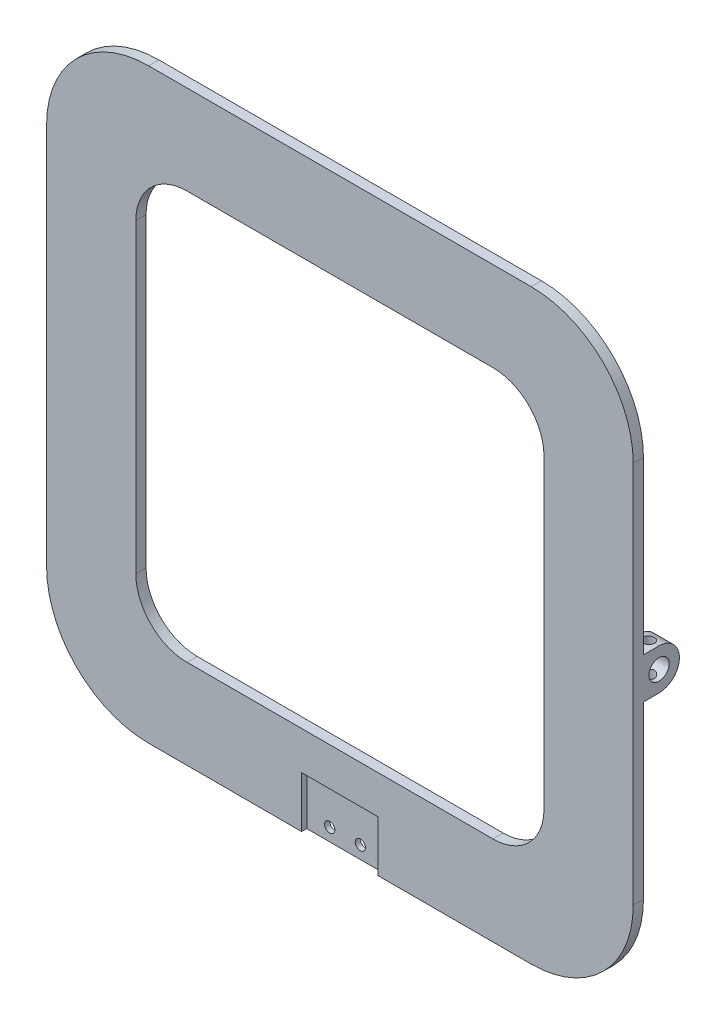
from build123d import *

# Parameters (mm, degrees)
SZKIC1_W                    = 115
SZKIC1_H                    = 115
DODANIE_WYCI_GNI_CIE1_DEPTH = 2
DODANIE_WYCI_GNI_CIE2_DEPTH = 4
SZKIC5_R                    = 2
WYTNIJ_WYCI_GNI_CIE1_DEPTH  = 163.787318778
SZKIC6_R                    = 1
WYTNIJ_WYCI_GNI_CIE2_DEPTH  = 10
ZAOKR_GLENIE1_R             = 20
SZKIC7_W                    = 15
SZKIC7_H                    = 10
WYTNIJ_WYCI_GNI_CIE3_DEPTH  = 1
WYTNIJ_WYCI_GNI_CIE4_DEPTH  = 10
SZKIC9_R                    = 1.1
WYTNIJ_WYCI_GNI_CIE5_DEPTH  = 131.602301492
SZKIC10_R                   = 1.1
WYTNIJ_WYCI_GNI_CIE6_DEPTH  = 10


with BuildPart() as part:
    # Szkic1 → Dodanie-wyciągnięcie1 (new body)
    with BuildSketch(Plane.XY):
        with Locations((57.5, -57.5)):
            Rectangle(SZKIC1_W, SZKIC1_H)
    extrude(amount=DODANIE_WYCI_GNI_CIE1_DEPTH)

    # Szkic3 → Dodanie-wyciągnięcie2 (add)
    with BuildSketch(Plane(origin=(115, 0, 0), x_dir=(0, 0, -1), z_dir=(1, 0, 0))):
        with BuildLine():
            Line((0, -53.5), (3.050613798, -53.5))
            ThreePointArc((3.050613798, -53.5), (7.050613798, -57.5), (3.050613798, -61.5))
            Line((3.050613798, -61.5), (0, -61.5))
            Line((0, -61.5), (0, -53.5))
        make_face()
    dodanie_wyci_gni_cie2 = extrude(amount=-DODANIE_WYCI_GNI_CIE2_DEPTH)

    # Lustro1: Dodanie-wyciągnięcie2 across plane
    add(dodanie_wyci_gni_cie2.mirror(Plane(origin=(57.5, 0, 0), x_dir=(0, 0, 1), z_dir=(1, 0, 0))))

    # Szkic5 → Wytnij-wyciągnięcie1 (cut, through all)
    with BuildSketch(Plane(origin=(115, 0, 0), x_dir=(0, 0, -1), z_dir=(1, 0, 0))):
        with Locations((3.050613798, -57.5)):
            Circle(SZKIC5_R)
    extrude(amount=-WYTNIJ_WYCI_GNI_CIE1_DEPTH, mode=Mode.SUBTRACT)

    # Szkic6 → Wytnij-wyciągnięcie2 (cut)
    with BuildSketch(Plane.XY.offset(2)):
        with Locations((54.5, -112.5)):
            Circle(SZKIC6_R)
        with Locations((60.5, -112.5)):
            Circle(SZKIC6_R)
    extrude(amount=-WYTNIJ_WYCI_GNI_CIE2_DEPTH, mode=Mode.SUBTRACT)

    # Zaokrąglenie1
    zaokr_glenie1_edges = [part.edges().sort_by_distance(p)[0] for p in [
        (0, -115, 1),
        (115, -115, 1),
        (0, 0, 1),
        (115, 0, 1),
    ]]
    fillet(zaokr_glenie1_edges, radius=ZAOKR_GLENIE1_R)

    # Szkic7 → Wytnij-wyciągnięcie3 (cut)
    with BuildSketch(Plane.XY.offset(2)):
        with Locations((57.5, -110)):
            Rectangle(SZKIC7_W, SZKIC7_H)
    extrude(amount=-WYTNIJ_WYCI_GNI_CIE3_DEPTH, mode=Mode.SUBTRACT)

    # Szkic8 → Wytnij-wyciągnięcie4 (cut)
    with BuildSketch(Plane(origin=(0, 0, 0), x_dir=(-1, 0, 0), z_dir=(0, 0, -1))):
        with BuildLine():
            Line((-87.5, -97.5), (-27.5, -97.5))
            ThreePointArc((-27.5, -97.5), (-20.428932188, -94.571067812), (-17.5, -87.5))
            Line((-17.5, -87.5), (-17.5, -27.5))
            ThreePointArc((-17.5, -27.5), (-20.428932188, -20.428932188), (-27.5, -17.5))
            Line((-27.5, -17.5), (-87.5, -17.5))
            ThreePointArc((-87.5, -17.5), (-94.571067812, -20.428932188), (-97.5, -27.5))
            Line((-97.5, -27.5), (-97.5, -87.5))
            ThreePointArc((-97.5, -87.5), (-94.571067812, -94.571067812), (-87.5, -97.5))
        make_face()
    extrude(amount=-WYTNIJ_WYCI_GNI_CIE4_DEPTH, mode=Mode.SUBTRACT)

    # Szkic9 → Wytnij-wyciągnięcie5 (cut, through all)
    with BuildSketch(Plane(origin=(0, -53.5, 0), x_dir=(1, 0, 0), z_dir=(0, 1, 0))):
        with Locations((2, 3.050613798)):
            Circle(SZKIC9_R)
    extrude(amount=-WYTNIJ_WYCI_GNI_CIE5_DEPTH, mode=Mode.SUBTRACT)

    # Szkic10 → Wytnij-wyciągnięcie6 (cut)
    with BuildSketch(Plane(origin=(0, -53.5, 0), x_dir=(1, 0, 0), z_dir=(0, 1, 0))):
        with Locations((113, 3.050613798)):
            Circle(SZKIC10_R)
    extrude(amount=-WYTNIJ_WYCI_GNI_CIE6_DEPTH, mode=Mode.SUBTRACT)


solid = part.part
